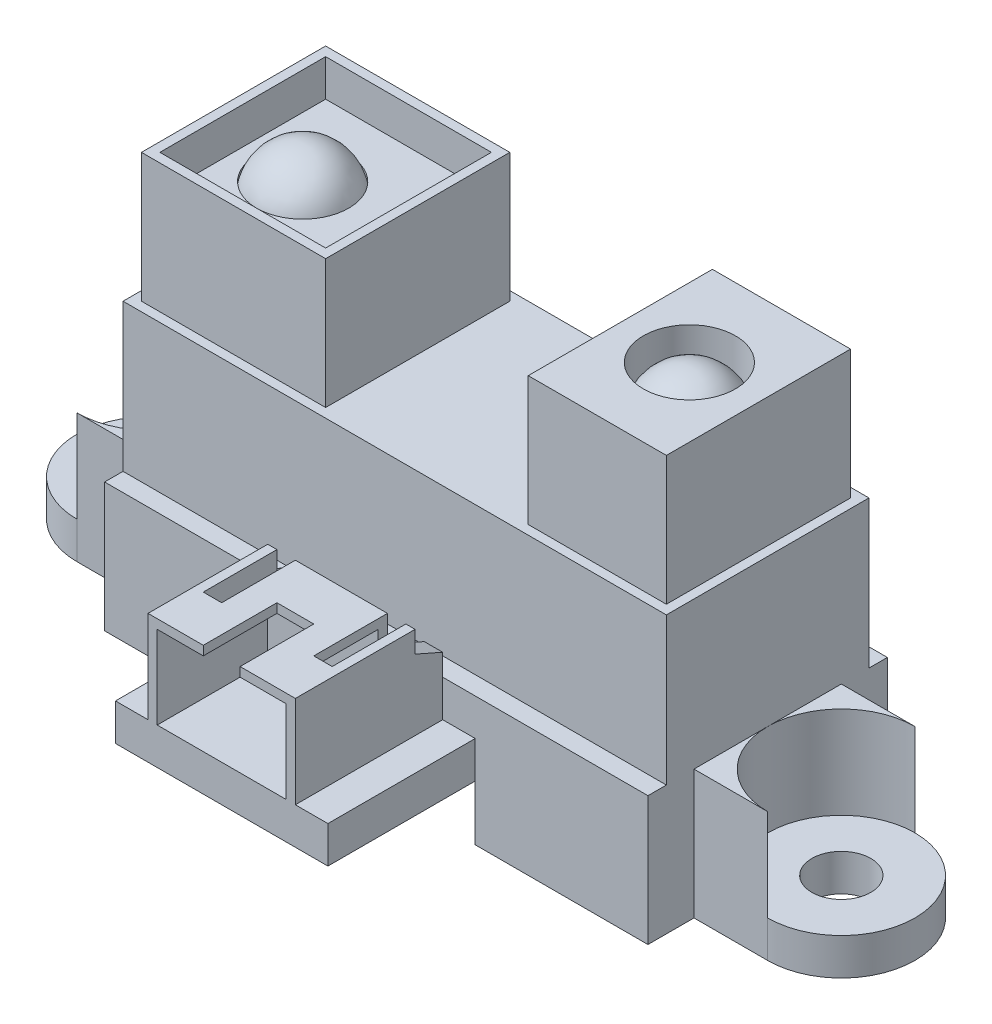
from build123d import *

# Parameters (mm, degrees)
EXTRUDE_1_DEPTH     = 7
CUT_EXTRUDE_START   = -5
SKETCH_2_R          = 4
CUT_EXTRUDE_1_DEPTH = 5
SKETCH_3_W          = 29.5
SKETCH_3_H          = 11
EXTRUDE_2_DEPTH     = 8
SKETCH_4_W          = 7.5
SKETCH_4_H          = 10
SKETCH_4_W_2        = 10
EXTRUDE_3_DEPTH     = 7
SKETCH_5_W          = 9
SKETCH_5_H          = 9
CUT_EXTRUDE_2_DEPTH = 2
SKETCH_6_R          = 2.5
CUT_EXTRUDE_3_DEPTH = 2.2
SKETCH_7_R          = 1.6
CUT_EXTRUDE_4_DEPTH = 45.443784717
SKETCH_8_W          = 11.533749137
SKETCH_8_H          = 5
EXTRUDE_4_DEPTH     = 8
CUT_EXTRUDE_5_DEPTH = 3
SKETCH_11_W         = 8
SKETCH_11_H         = 6.5
EXTRUDE_6_DEPTH     = 5
EXTRUDE_7_DEPTH     = 1
EXTRUDE_8_DEPTH     = 1
CUT_EXTRUDE_6_DEPTH = 4
SKETCH_15_W         = 7
SKETCH_15_H         = 4.5
CUT_EXTRUDE_7_DEPTH = 2
SKETCH_16_W         = 1
SKETCH_16_H         = 4
CUT_EXTRUDE_8_DEPTH = 1


# Read off the part's stored shape, not the designer's step: 圆顶1, 圆顶2
with BuildPart() as part:
    # 草图1 → 凸台-拉伸1 (new body)
    with BuildSketch(Plane(origin=(0, 0, 0), x_dir=(1, 0, 0), z_dir=(0, 1, 0))):
        with BuildLine():
            Line((0, 0), (29.5, 0))
            Line((29.5, 0), (29.5, -2.5))
            Line((29.5, -2.5), (33.5, -2.5))
            ThreePointArc((33.5, -2.5), (37.5, -6.5), (33.5, -10.5))
            Line((33.5, -10.5), (29.5, -10.5))
            Line((29.5, -10.5), (29.5, -13))
            Line((29.5, -13), (0, -13))
            Line((0, -13), (0, -10.5))
            Line((0, -10.5), (-4, -10.5))
            ThreePointArc((-4, -10.5), (-8, -6.5), (-4, -2.5))
            Line((-4, -2.5), (0, -2.5))
            Line((0, -2.5), (0, 0))
        make_face()
    extrude(amount=EXTRUDE_1_DEPTH)

    # 草图2 → 切除-拉伸1 (cut)
    with BuildSketch(Plane(origin=(0, 7, 0), x_dir=(1, 0, 0), z_dir=(0, 1, 0)).offset(CUT_EXTRUDE_START)):
        with Locations((-4, -6.5)):
            Circle(SKETCH_2_R)
        with Locations((33.5, -6.5)):
            Circle(SKETCH_2_R)
    extrude(amount=CUT_EXTRUDE_1_DEPTH, mode=Mode.SUBTRACT)

    # 草图3 → 凸台-拉伸2 (add)
    with BuildSketch(Plane(origin=(0, 7, 0), x_dir=(1, 0, 0), z_dir=(0, 1, 0))):
        with Locations((14.75, -6.5)):
            Rectangle(SKETCH_3_W, SKETCH_3_H)
    extrude(amount=EXTRUDE_2_DEPTH)

    # 草图4 → 凸台-拉伸3 (add)
    with BuildSketch(Plane(origin=(0, 15, 0), x_dir=(1, 0, 0), z_dir=(0, 1, 0))):
        with Locations((25.25, -6.5)):
            Rectangle(SKETCH_4_W, SKETCH_4_H)
        with Locations((5.5, -6.5)):
            Rectangle(SKETCH_4_W_2, SKETCH_4_H)
    extrude(amount=EXTRUDE_3_DEPTH)

    # 草图5 → 切除-拉伸2 (cut)
    with BuildSketch(Plane(origin=(0, 22, 0), x_dir=(1, 0, 0), z_dir=(0, 1, 0))):
        with Locations((5.5, -6.5)):
            Rectangle(SKETCH_5_W, SKETCH_5_H)
    extrude(amount=-CUT_EXTRUDE_2_DEPTH, mode=Mode.SUBTRACT)

    # 草图6 → 切除-拉伸3 (cut)
    with BuildSketch(Plane(origin=(0, 22, 0), x_dir=(1, 0, 0), z_dir=(0, 1, 0))):
        with Locations(Location((25.25, -6.5, 0), (0, 0, 270))):
            Circle(SKETCH_6_R)
        with Locations(Location((4.253331237, -6.5, 0), (0, 0, 270))):
            Circle(SKETCH_6_R)
    extrude(amount=-CUT_EXTRUDE_3_DEPTH, mode=Mode.SUBTRACT)

    # 圆顶1 outline → 圆顶1 (revolve)
    with BuildSketch(Plane(origin=(4.253331237, 0, 6.5), x_dir=(1, 0, 0), z_dir=(0, 0, 1))):
        with BuildLine():
            Line((0, 19.8), (2.500000001, 19.799999998))
            ThreePointArc((2.500000001, 19.799999998), (1.60078106, 21.238476323), (0, 21.8))
            Line((0, 21.8), (0, 19.8))
        make_face()
    revolve(axis=Axis((4.253331237, 0, 6.5), (0, 1, 0)))

    # 圆顶2 outline → 圆顶2 (revolve)
    with BuildSketch(Plane(origin=(25.25, 0, 6.5), x_dir=(1, 0, 0), z_dir=(0, 0, 1))):
        with BuildLine():
            Line((0, 19.8), (2.500000001, 19.799999997))
            ThreePointArc((2.500000001, 19.799999997), (1.60078106, 21.238476323), (0, 21.8))
            Line((0, 21.8), (0, 19.8))
        make_face()
    revolve(axis=Axis((25.25, 0, 6.5), (0, 1, 0)))

    # 草图7 → 切除-拉伸4 (cut, through all)
    with BuildSketch(Plane(origin=(0, 2, 0), x_dir=(1, 0, 0), z_dir=(0, 1, 0))):
        with Locations(Location((-4, -6.5, 0), (0, 0, 270))):
            Circle(SKETCH_7_R)
        with Locations(Location((33.5, -6.5, 0), (0, 0, 270))):
            Circle(SKETCH_7_R)
    extrude(amount=-CUT_EXTRUDE_4_DEPTH, mode=Mode.SUBTRACT)

    # 草图8 → 凸台-拉伸4 (add)
    with BuildSketch(Plane.XY.offset(13)):
        with Locations((14.355989937, 2.5)):
            Rectangle(SKETCH_8_W, SKETCH_8_H)
    extrude(amount=EXTRUDE_4_DEPTH)

    # 草图10 → 切除-拉伸5 (cut)
    with BuildSketch(Plane.XZ):
        Polygon((8.589115368, 21), (8.589115368, 12), (1, 12), (1, 1), (28.5, 1), (28.5, 12), (20.122864505, 12), (20.122864505, 21), align=None)
    extrude(amount=-CUT_EXTRUDE_5_DEPTH, mode=Mode.SUBTRACT)

    # 草图11 → 凸台-拉伸6 (add)
    with BuildSketch(Plane(origin=(0, 5, 0), x_dir=(1, 0, 0), z_dir=(0, 1, 0))):
        with Locations((14.355989936, -17.75)):
            Rectangle(SKETCH_11_W, SKETCH_11_H)
    extrude(amount=EXTRUDE_6_DEPTH)

    # 草图12 → 凸台-拉伸7 (add)
    with BuildSketch(Plane(origin=(18.355989936, 0, 0), x_dir=(0, 0, -1), z_dir=(1, 0, 0))):
        Polygon((-14.5, 8.832927064), (-13, 8.172497524), (-13, 5), (-14.5, 5), align=None)
    extrude(amount=-EXTRUDE_7_DEPTH)

    # 草图13 → 凸台-拉伸8 (add)
    with BuildSketch(Plane.ZY.offset(-10.355989936)):
        Polygon((14.5, 8.832927064), (13, 8.172497524), (13, 5), (14.5, 5), align=None)
    extrude(amount=-EXTRUDE_8_DEPTH)

    # 草图14 → 切除-拉伸6 (cut)
    with BuildSketch(Plane.XY.offset(21)):
        Polygon((10.855989936, 5), (17.855989936, 5), (17.855989936, 9.5), (15.355989936, 9.5), (15.355989936, 10), (13.355989936, 10), (13.355989936, 9.5), (10.855989936, 9.5), align=None)
    extrude(amount=-CUT_EXTRUDE_6_DEPTH, mode=Mode.SUBTRACT)

    # 草图15 → 切除-拉伸7 (cut)
    with BuildSketch(Plane.XY.offset(17)):
        with Locations((14.355989936, 7.25)):
            Rectangle(SKETCH_15_W, SKETCH_15_H)
    extrude(amount=-CUT_EXTRUDE_7_DEPTH, mode=Mode.SUBTRACT)

    # 草图16 → 切除-拉伸8 (cut)
    with BuildSketch(Plane(origin=(0, 10, 0), x_dir=(1, 0, 0), z_dir=(0, 1, 0))):
        with Locations((11.355989936, -16.5)):
            Rectangle(SKETCH_16_W, SKETCH_16_H)
        with Locations((17.355989936, -16.5)):
            Rectangle(SKETCH_16_W, SKETCH_16_H)
    extrude(amount=-CUT_EXTRUDE_8_DEPTH, mode=Mode.SUBTRACT)


solid = part.part
